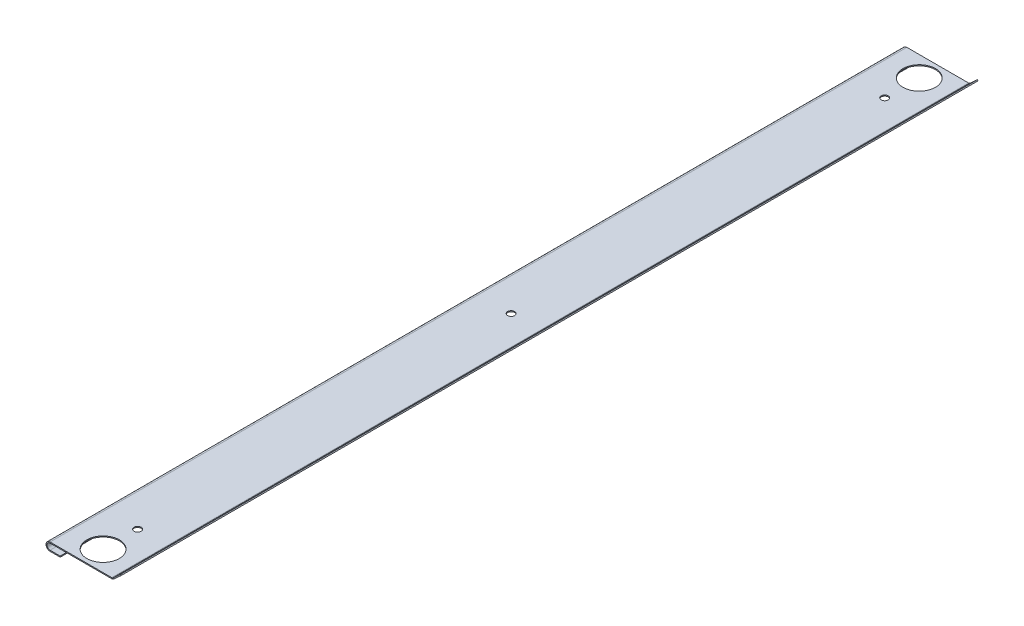
from build123d import *

# Parameters (mm, degrees)
BASE_FLANGE1_DEPTH = 211
SKETCH2_R          = 8
EXTRUDE2_DEPTH     = 214.604031327
SKETCH3_R          = 1.75
EXTRUDE3_DEPTH     = 0.5
SKETCH4_R          = 1.75
EXTRUDE4_DEPTH     = 0.5


# Sheet-metal steps are written as plain solids
with BuildPart() as part:
    # Sketch1 → Base-Flange1 (new, symmetric)
    with BuildSketch(Plane.XY):
        with BuildLine():
            Line((4.055025352, 3.715746142), (0.430067214, 0.394083995))
            ThreePointArc((0.430067214, 0.394083995), (-0.03966104, 0.101988196), (-0.583318098, 0))
            Line((-0.583318098, 0), (-31, 0))
            ThreePointArc((-31, 0), (-32.5, -1.5), (-31, -3))
            Line((-31, -3), (-26, -3))
            Line((-26, -3), (-26, -3.5))
            Line((-26, -3.5), (-31, -3.5))
            ThreePointArc((-31, -3.5), (-33, -1.5), (-31, 0.5))
            Line((-31, 0.5), (-0.583318098, 0.5))
            ThreePointArc((-0.583318098, 0.5), (-0.220880059, 0.567992131), (0.09227211, 0.762722663))
            Line((0.09227211, 0.762722663), (3.717230249, 4.08438481))
            Line((3.717230249, 4.08438481), (4.055025352, 3.715746142))
        make_face()
    extrude(amount=BASE_FLANGE1_DEPTH, both=True)

    # Sketch2 → Extrude2 (cut, through all)
    with BuildSketch(Plane(origin=(0, 0, 0), x_dir=(1, 0, 0), z_dir=(0, 1, 0))):
        with Locations(Location((-14.883318098, 201, 0), (0, 0, 180))):
            Circle(SKETCH2_R)
        with Locations(Location((-14.883318098, -201, 0), (0, 0, 90))):
            Circle(SKETCH2_R)
    extrude(amount=EXTRUDE2_DEPTH, mode=Mode.SUBTRACT)

    # Sketch3 → Extrude3 (cut)
    with BuildSketch(Plane(origin=(0, 0.5, 0), x_dir=(1, 0, 0), z_dir=(0, 1, 0))):
        with Locations(Location((-14.883318098, 0, 0), (0, 0, 180))):
            Circle(SKETCH3_R)
    extrude(amount=-EXTRUDE3_DEPTH, mode=Mode.SUBTRACT)

    # Sketch4 → Extrude4 (cut)
    with BuildSketch(Plane(origin=(0, 0.5, 0), x_dir=(1, 0, 0), z_dir=(0, 1, 0))):
        with Locations(Location((-14.883318098, 184, 0), (0, 0, 180))):
            Circle(SKETCH4_R)
        with Locations((-14.883318098, -184)):
            Circle(SKETCH4_R)
    extrude(amount=-EXTRUDE4_DEPTH, mode=Mode.SUBTRACT)


solid = part.part
